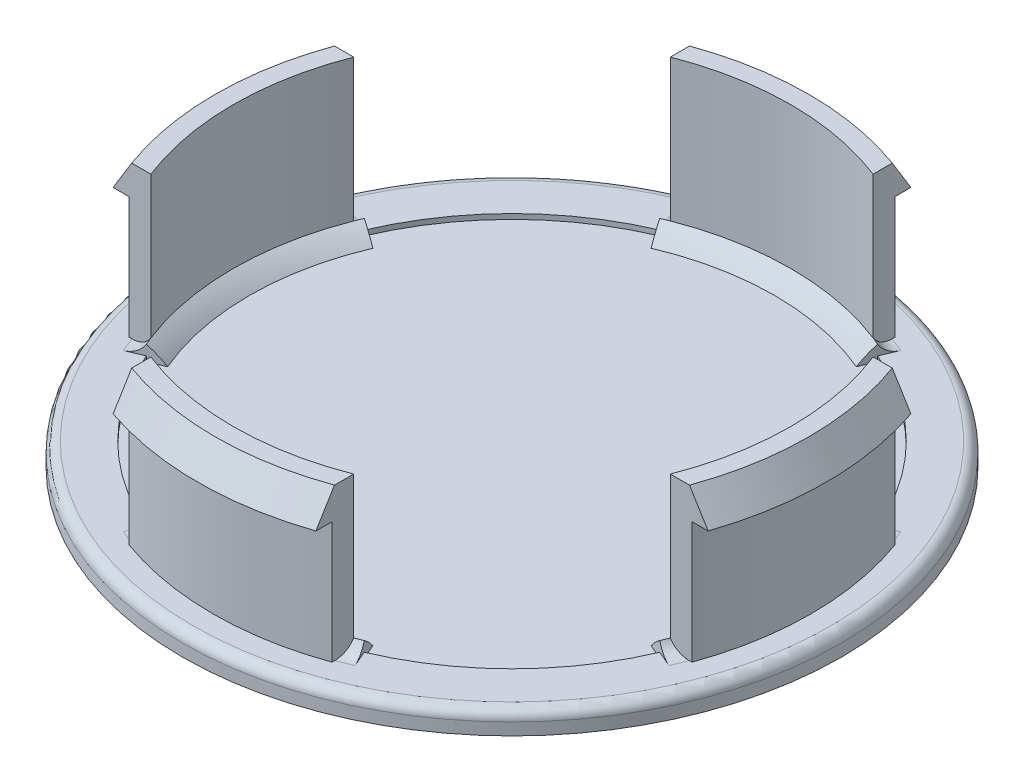
from build123d import *

# Parameters (mm, degrees)
CUT_EXTRUDE_1_REACH      = 51.075
REVOLVE_2_ANGLE          = 46
PATTERN_CIRCULAR_6_COUNT = 4
FILLET_3_R               = 2
SKETCH_4_R               = 0.25
EXTRUDE_1_DEPTH          = 2.5


with BuildPart() as part:
    # Эскиз1 → Повернуть1 (revolve)
    with BuildSketch(Plane.XY, mode=Mode.PRIVATE) as revolve_1_sk:
        with BuildLine():
            Line((0, 0), (-32.5, 0))
            Line((-32.5, 0), (-32.5, 1.2))
            ThreePointArc((-32.5, 1.2), (-32.207106781, 1.907106781), (-31.5, 2.2))
            Line((-31.5, 2.2), (-29.5, 2.2))
            Line((-29.5, 2.2), (-29.5, 14.2))
            Line((-29.5, 14.2), (-31, 14.2))
            Line((-31, 14.2), (-29.267949192, 17.2))
            Line((-29.267949192, 17.2), (-27.5, 17.2))
            Line((-27.5, 17.2), (-27.5, 1.7))
            Line((-27.5, 1.7), (0, 1.7))
            Line((0, 1.7), (0, 0))
        make_face()
    revolve(revolve_1_sk.sketch.rotate(Axis((0, 0, 0), (0, -1, 0)), 270), axis=Axis((0, 0, 0), (0, -1, 0)))

    # Вырез-Вытянуть1: up to this face of the body (flat: up to its plane)
    cut_extrude_1_end = Plane(part.part.faces().sort_by_distance((0, 2.2, -30.609045456))[0])
    # Эскиз2 → Вырез-Вытянуть1 (cut, up to the picked face)
    with BuildSketch(Plane(origin=(0, 17.2, 0), x_dir=(1, 0, 0), z_dir=(0, 1, 0)), mode=Mode.PRIVATE) as cut_extrude_1_sk1:
        with BuildLine():
            Line((-10, 27.50659648), (-10, 40.856644609))
            ThreePointArc((-10, 40.856644609), (-29.742775667, 29.742775667), (-40.856644609, 10))
            Line((-40.856644609, 10), (-27.50659648, 10))
            ThreePointArc((-27.50659648, 10), (-20.695565345, 20.695565345), (-10, 27.50659648))
        make_face()
    cut_extrude_1_tool1 = split(extrude(cut_extrude_1_sk1.sketch, amount=-CUT_EXTRUDE_1_REACH, mode=Mode.PRIVATE), bisect_by=cut_extrude_1_end, keep=Keep.BOTH, mode=Mode.PRIVATE)
    # Эскиз2 → Вырез-Вытянуть1 (cut, up to the picked face)
    with BuildSketch(Plane(origin=(0, 17.2, 0), x_dir=(1, 0, 0), z_dir=(0, 1, 0)), mode=Mode.PRIVATE) as cut_extrude_1_sk2:
        with BuildLine():
            ThreePointArc((27.50659648, 10), (20.695565345, 20.695565345), (10, 27.50659648))
            Line((10, 27.50659648), (10, 25.617376915))
            ThreePointArc((10, 25.617376915), (19.445436483, 19.445436483), (25.617376915, 10))
            Line((25.617376915, 10), (27.50659648, 10))
        make_face()
    cut_extrude_1_tool2 = split(extrude(cut_extrude_1_sk2.sketch, amount=-CUT_EXTRUDE_1_REACH, mode=Mode.PRIVATE), bisect_by=cut_extrude_1_end, keep=Keep.BOTH, mode=Mode.PRIVATE)
    # Эскиз2 → Вырез-Вытянуть1 (cut, up to the picked face)
    with BuildSketch(Plane(origin=(0, 17.2, 0), x_dir=(1, 0, 0), z_dir=(0, 1, 0)), mode=Mode.PRIVATE) as cut_extrude_1_sk3:
        with BuildLine():
            ThreePointArc((40.856644609, 10), (29.742775667, 29.742775667), (10, 40.856644609))
            Line((10, 40.856644609), (10, 27.50659648))
            ThreePointArc((10, 27.50659648), (20.695565345, 20.695565345), (27.50659648, 10))
            Line((27.50659648, 10), (40.856644609, 10))
        make_face()
    cut_extrude_1_tool3 = split(extrude(cut_extrude_1_sk3.sketch, amount=-CUT_EXTRUDE_1_REACH, mode=Mode.PRIVATE), bisect_by=cut_extrude_1_end, keep=Keep.BOTH, mode=Mode.PRIVATE)
    # Эскиз2 → Вырез-Вытянуть1 (cut, up to the picked face)
    with BuildSketch(Plane(origin=(0, 17.2, 0), x_dir=(1, 0, 0), z_dir=(0, 1, 0)), mode=Mode.PRIVATE) as cut_extrude_1_sk4:
        with BuildLine():
            ThreePointArc((10, -40.856644609), (29.742775667, -29.742775667), (40.856644609, -10))
            Line((40.856644609, -10), (27.50659648, -10))
            ThreePointArc((27.50659648, -10), (20.695565345, -20.695565345), (10, -27.50659648))
            Line((10, -27.50659648), (10, -40.856644609))
        make_face()
    cut_extrude_1_tool4 = split(extrude(cut_extrude_1_sk4.sketch, amount=-CUT_EXTRUDE_1_REACH, mode=Mode.PRIVATE), bisect_by=cut_extrude_1_end, keep=Keep.BOTH, mode=Mode.PRIVATE)
    # Эскиз2 → Вырез-Вытянуть1 (cut, up to the picked face)
    with BuildSketch(Plane(origin=(0, 17.2, 0), x_dir=(1, 0, 0), z_dir=(0, 1, 0)), mode=Mode.PRIVATE) as cut_extrude_1_sk5:
        with BuildLine():
            ThreePointArc((10, -27.50659648), (20.695565345, -20.695565345), (27.50659648, -10))
            Line((27.50659648, -10), (25.617376915, -10))
            ThreePointArc((25.617376915, -10), (19.445436483, -19.445436483), (10, -25.617376915))
            Line((10, -25.617376915), (10, -27.50659648))
        make_face()
    cut_extrude_1_tool5 = split(extrude(cut_extrude_1_sk5.sketch, amount=-CUT_EXTRUDE_1_REACH, mode=Mode.PRIVATE), bisect_by=cut_extrude_1_end, keep=Keep.BOTH, mode=Mode.PRIVATE)
    # Эскиз2 → Вырез-Вытянуть1 (cut, up to the picked face)
    with BuildSketch(Plane(origin=(0, 17.2, 0), x_dir=(1, 0, 0), z_dir=(0, 1, 0)), mode=Mode.PRIVATE) as cut_extrude_1_sk6:
        with BuildLine():
            Line((-27.50659648, -10), (-40.856644609, -10))
            ThreePointArc((-40.856644609, -10), (-29.742775667, -29.742775667), (-10, -40.856644609))
            Line((-10, -40.856644609), (-10, -27.50659648))
            ThreePointArc((-10, -27.50659648), (-20.695565345, -20.695565345), (-27.50659648, -10))
        make_face()
    cut_extrude_1_tool6 = split(extrude(cut_extrude_1_sk6.sketch, amount=-CUT_EXTRUDE_1_REACH, mode=Mode.PRIVATE), bisect_by=cut_extrude_1_end, keep=Keep.BOTH, mode=Mode.PRIVATE)
    # Эскиз2 → Вырез-Вытянуть1 (cut, up to the picked face)
    with BuildSketch(Plane(origin=(0, 17.2, 0), x_dir=(1, 0, 0), z_dir=(0, 1, 0)), mode=Mode.PRIVATE) as cut_extrude_1_sk7:
        with BuildLine():
            Line((-25.617376915, -10), (-27.50659648, -10))
            ThreePointArc((-27.50659648, -10), (-20.695565345, -20.695565345), (-10, -27.50659648))
            Line((-10, -27.50659648), (-10, -25.617376915))
            ThreePointArc((-10, -25.617376915), (-19.445436483, -19.445436483), (-25.617376915, -10))
        make_face()
    cut_extrude_1_tool7 = split(extrude(cut_extrude_1_sk7.sketch, amount=-CUT_EXTRUDE_1_REACH, mode=Mode.PRIVATE), bisect_by=cut_extrude_1_end, keep=Keep.BOTH, mode=Mode.PRIVATE)
    # Эскиз2 → Вырез-Вытянуть1 (cut, up to the picked face)
    with BuildSketch(Plane(origin=(0, 17.2, 0), x_dir=(1, 0, 0), z_dir=(0, 1, 0)), mode=Mode.PRIVATE) as cut_extrude_1_sk8:
        with BuildLine():
            Line((-10, 25.617376915), (-10, 27.50659648))
            ThreePointArc((-10, 27.50659648), (-20.695565345, 20.695565345), (-27.50659648, 10))
            Line((-27.50659648, 10), (-25.617376915, 10))
            ThreePointArc((-25.617376915, 10), (-19.445436483, 19.445436483), (-10, 25.617376915))
        make_face()
    cut_extrude_1_tool8 = split(extrude(cut_extrude_1_sk8.sketch, amount=-CUT_EXTRUDE_1_REACH, mode=Mode.PRIVATE), bisect_by=cut_extrude_1_end, keep=Keep.BOTH, mode=Mode.PRIVATE)
    add(cut_extrude_1_tool1.solids().sort_by(Axis((-24.563821, 17.2, -24.563821), (0, -1, 0)))[0], mode=Mode.SUBTRACT)
    add(cut_extrude_1_tool2.solids().sort_by(Axis((19.481832, 17.2, -19.481832), (0, -1, 0)))[0], mode=Mode.SUBTRACT)
    add(cut_extrude_1_tool3.solids().sort_by(Axis((24.563821, 17.2, -24.563821), (0, -1, 0)))[0], mode=Mode.SUBTRACT)
    add(cut_extrude_1_tool4.solids().sort_by(Axis((24.563821, 17.2, 24.563821), (0, -1, 0)))[0], mode=Mode.SUBTRACT)
    add(cut_extrude_1_tool5.solids().sort_by(Axis((19.481832, 17.2, 19.481832), (0, -1, 0)))[0], mode=Mode.SUBTRACT)
    add(cut_extrude_1_tool6.solids().sort_by(Axis((-24.563821, 17.2, 24.563821), (0, -1, 0)))[0], mode=Mode.SUBTRACT)
    add(cut_extrude_1_tool7.solids().sort_by(Axis((-19.481832, 17.2, 19.481832), (0, -1, 0)))[0], mode=Mode.SUBTRACT)
    add(cut_extrude_1_tool8.solids().sort_by(Axis((-19.481832, 17.2, -19.481832), (0, -1, 0)))[0], mode=Mode.SUBTRACT)

    # Повернуть2: read off the stored shape, not the designer's step
    # Повернуть2 outline → Повернуть2 (revolve)
    with BuildSketch(Plane(origin=(0, 0, 0), x_dir=(-0.9205048534524393, 0, -0.3907311284892762), z_dir=(0.3907311284892762, 0, -0.9205048534524393))):
        with BuildLine():
            Line((27.5, 1.7), (27.5, 3.2))
            ThreePointArc((27.5, 3.2), (26.65909171, 2.493968314), (25.900657923, 1.7))
            Line((25.900657923, 1.7), (27.5, 1.7))
        make_face()
    revolve_2 = revolve(axis=Axis((0, 0, 0), (0, 1, 0)), revolution_arc=REVOLVE_2_ANGLE)

    # Круговой массив6: Повернуть2 ×4 about axis
    pattern_circular_6_axis = Axis((0, 0, 0), (0, 1, 0))
    for i in range(1, PATTERN_CIRCULAR_6_COUNT):
        add(revolve_2.rotate(pattern_circular_6_axis, i * 360 / PATTERN_CIRCULAR_6_COUNT))

    # Скругление3
    # the kernel refuses this fillet: 2 mm, written as the material it adds along each edge
    with BuildSketch(Plane(origin=(0, 2.2, 0), x_dir=(-0.21306345885577038, 0, -0.9770383628601365), z_dir=(0.9770383628601365, 0, -0.21306345885577038))) as fillet_3_piece_1:
        with BuildLine():
            CenterArc((29.232050808, 2), FILLET_3_R, 210, 60)
            Line((27.5, 1), (27.5, 0))
            Line((27.5, 0), (29.232050808, 0))
        make_face()
    revolve(axis=Axis((0, 2.2, 0), (0, 1, 0)), revolution_arc=10.698060555)
    with BuildSketch(Plane(origin=(0, 2.2, 0), x_dir=(-0.9205048534524419, 0, -0.39073112848927005), z_dir=(0.39073112848927005, 0, -0.9205048534524419))) as fillet_3_piece_2:
        with BuildLine():
            CenterArc((29.232050808, 2), FILLET_3_R, 210, 60)
            Line((27.5, 1), (27.5, 0))
            Line((27.5, 0), (29.232050808, 0))
        make_face()
    revolve(axis=Axis((0, 2.2, 0), (0, 1, 0)), revolution_arc=10.698060555)
    with BuildSketch(Plane(origin=(0, 2.2, 0), x_dir=(-0.3907311284892926, 0, 0.9205048534524323), z_dir=(-0.9205048534524323, 0, -0.3907311284892926))) as fillet_3_piece_3:
        with BuildLine():
            CenterArc((29.232050808, 2), FILLET_3_R, 210, 60)
            Line((27.5, 1), (27.5, 0))
            Line((27.5, 0), (29.232050808, 0))
        make_face()
    revolve(axis=Axis((0, 2.2, 0), (0, 1, 0)), revolution_arc=10.698060555)
    with BuildSketch(Plane(origin=(0, 2.2, 0), x_dir=(0.9205048534524326, 0, 0.3907311284892922), z_dir=(-0.3907311284892922, 0, 0.9205048534524326))) as fillet_3_piece_4:
        with BuildLine():
            CenterArc((29.232050808, 2), FILLET_3_R, 210, 60)
            Line((27.5, 1), (27.5, 0))
            Line((27.5, 0), (29.232050808, 0))
        make_face()
    revolve(axis=Axis((0, 2.2, 0), (0, 1, 0)), revolution_arc=10.698060555)
    with BuildSketch(Plane(origin=(0, 2.2, 0), x_dir=(0.3907311284892925, 0, -0.9205048534524325), z_dir=(0.9205048534524325, 0, 0.3907311284892925))) as fillet_3_piece_5:
        with BuildLine():
            CenterArc((29.232050808, 2), FILLET_3_R, 210, 60)
            Line((27.5, 1), (27.5, 0))
            Line((27.5, 0), (29.232050808, 0))
        make_face()
    revolve(axis=Axis((0, 2.2, 0), (0, 1, 0)), revolution_arc=10.698060555)
    with BuildSketch(Plane(origin=(0, 2.2, 0), x_dir=(0.9770383628601332, 0, -0.21306345885578468), z_dir=(0.21306345885578468, 0, 0.9770383628601332))) as fillet_3_piece_6:
        with BuildLine():
            CenterArc((29.232050808, 2), FILLET_3_R, 210, 60)
            Line((27.5, 1), (27.5, 0))
            Line((27.5, 0), (29.232050808, 0))
        make_face()
    revolve(axis=Axis((0, 2.2, 0), (0, 1, 0)), revolution_arc=10.698060555)
    with BuildSketch(Plane(origin=(0, 2.2, 0), x_dir=(0.21306345885579284, 0, 0.9770383628601315), z_dir=(-0.9770383628601315, 0, 0.21306345885579284))) as fillet_3_piece_7:
        with BuildLine():
            CenterArc((29.232050808, 2), FILLET_3_R, 210, 60)
            Line((27.5, 1), (27.5, 0))
            Line((27.5, 0), (29.232050808, 0))
        make_face()
    revolve(axis=Axis((0, 2.2, 0), (0, 1, 0)), revolution_arc=10.698060555)
    with BuildSketch(Plane(origin=(0, 2.2, 0), x_dir=(-0.9770383628601342, 0, 0.21306345885578018), z_dir=(-0.21306345885578018, 0, -0.9770383628601342))) as fillet_3_piece_8:
        with BuildLine():
            CenterArc((29.232050808, 2), FILLET_3_R, 210, 60)
            Line((27.5, 1), (27.5, 0))
            Line((27.5, 0), (29.232050808, 0))
        make_face()
    revolve(axis=Axis((0, 2.2, 0), (0, 1, 0)), revolution_arc=10.698060555)

    # Эскиз4 → Бобышка-Вытянуть1 (add)
    with BuildSketch(Plane(origin=(0, 0, 0), x_dir=(-1, 0, 0), z_dir=(0, -1, 0))):
        Circle(SKETCH_4_R)
        Polygon((-8.5, -14), (0, 0), (8.5, -14), (0, -28), align=None)
        Polygon((16.374355653, -0.361215932), (0, 0), (7.874355653, 14.361215932), (24.248711306, 14), align=None)
        Polygon((-7.874355653, 14.361215932), (0, 0), (-16.374355653, -0.361215932), (-24.248711306, 14), align=None)
        with BuildLine():
            ThreePointArc((-0.249939193, -0.005513623), (-0.216506351, -0.125), (-0.129744534, -0.213696879))
            Line((-0.129744534, -0.213696879), (0, 0))
            Line((0, 0), (-0.249939193, -0.005513623))
        make_face()
        with BuildLine():
            ThreePointArc((-0.129744534, -0.213696879), (0, -0.25), (0.129744534, -0.213696879))
            Line((0.129744534, -0.213696879), (0, 0))
            Line((0, 0), (-0.129744534, -0.213696879))
        make_face()
        with BuildLine():
            Line((0, 0), (0.129744534, -0.213696879))
            ThreePointArc((0.129744534, -0.213696879), (0.216506351, -0.125), (0.249939193, -0.005513623))
            Line((0.249939193, -0.005513623), (0, 0))
        make_face()
        with BuildLine():
            Line((-0.120194659, 0.219210501), (0, 0))
            Line((0, 0), (0.120194659, 0.219210501))
            ThreePointArc((0.120194659, 0.219210501), (0, 0.25), (-0.120194659, 0.219210501))
        make_face()
        with BuildLine():
            Line((0.120194659, 0.219210501), (0, 0))
            Line((0, 0), (0.249939193, -0.005513623))
            ThreePointArc((0.249939193, -0.005513623), (0.249984798, -0.002756979), (0.25, 0))
            ThreePointArc((0.25, 0), (0.215114696, 0.127380013), (0.120194659, 0.219210501))
        make_face()
        with BuildLine():
            Line((-0.249939193, -0.005513623), (0, 0))
            Line((0, 0), (-0.120194659, 0.219210501))
            ThreePointArc((-0.120194659, 0.219210501), (-0.216506351, 0.125), (-0.249939193, -0.005513623))
        make_face()
    extrude(amount=EXTRUDE_1_DEPTH)


solid = part.part
